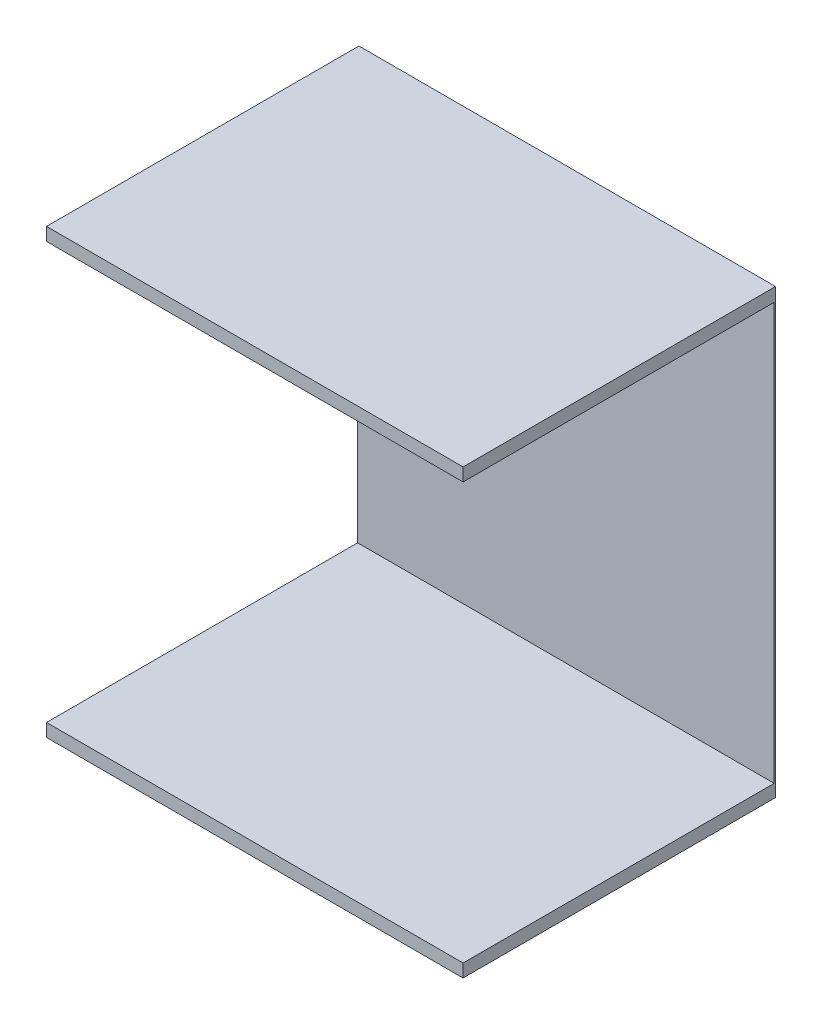
from build123d import *

# Parameters (mm, degrees)
SKETCH1_W             = 203.2
SKETCH1_H             = 6.35
BOSS_EXTRUDE1_DEPTH   = 152.4
BOSS_EXTRUDE1_2_DEPTH = 152.4
BOSS_EXTRUDE2_DEPTH   = 0.635


with BuildPart() as part:
    # Sketch1 → Boss-Extrude1 (new body)
    with BuildSketch(Plane.XY):
        with Locations((101.6, -206.375)):
            Rectangle(SKETCH1_W, SKETCH1_H)
    extrude(amount=BOSS_EXTRUDE1_DEPTH)



with BuildPart() as body_2:
    # Sketch1 → Boss-Extrude1 2 (new body)
    with BuildSketch(Plane.XY):
        with Locations((101.6, 3.175)):
            Rectangle(SKETCH1_W, SKETCH1_H)
    extrude(amount=BOSS_EXTRUDE1_2_DEPTH)


with BuildPart() as part_1:
    add(part.part)

    add(body_2.part)  # Boss-Extrude2 merges body 2
    # Sketch3 → Boss-Extrude2 (add)
    with BuildSketch(Plane(origin=(0, 0, 0), x_dir=(-1, 0, 0), z_dir=(0, 0, -1))):
        Polygon((0, -206.375), (-203.2, -209.55), (-203.2, 6.35), (0, 6.35), align=None)
    extrude(amount=-BOSS_EXTRUDE2_DEPTH)


solid = part_1.part
